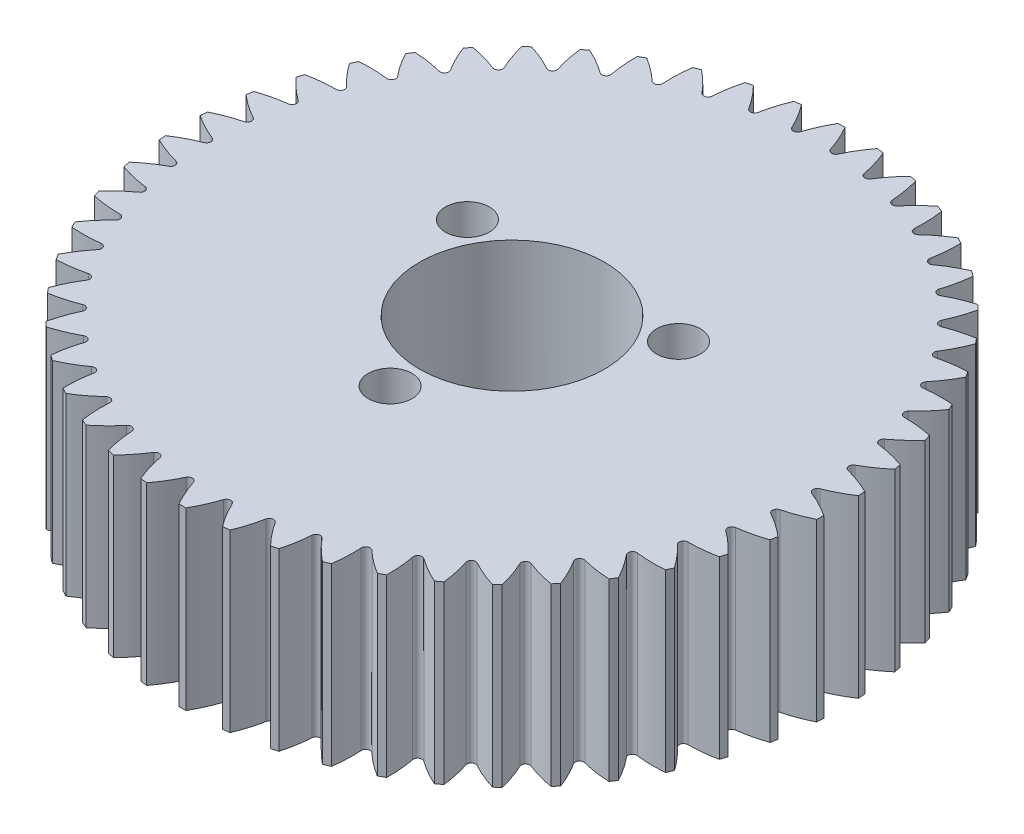
from build123d import *

# Parameters (mm, degrees)
SKETCH1_W                                        = 33.8
SKETCH1_H                                        = 18
CUT_EXTRUDE1_DEPTH                               = 52.077196477
CIRPATTERN1_COUNT                                = 50
CBORE_FOR_M4_HEX_HEAD_MACHINE_SCREW1_D           = 4.5
CBORE_FOR_M4_HEX_HEAD_MACHINE_SCREW1_CBORE_D     = 8.25
CBORE_FOR_M4_HEX_HEAD_MACHINE_SCREW1_CBORE_DEPTH = 4
F_19_0_19_DIAMETER_HOLE1_D                       = 19
FILLET1_R                                        = 3


with BuildPart() as part:
    # Sketch1 → Revolve1 (revolve)
    with BuildSketch(Plane(origin=(0, 0, 0), x_dir=(-1, 0, 0), z_dir=(0, 0, -1)), mode=Mode.PRIVATE) as revolve1_sk:
        with Locations((-16.9, -9)):
            Rectangle(SKETCH1_W, SKETCH1_H)
    revolve(revolve1_sk.sketch.rotate(Axis((0, -18, 0), (0, 1, 0)), 270), axis=Axis((0, -18, 0), (0, 1, 0)))

    # Sketch2 → Cut-Extrude1 (cut, through all)
    with BuildSketch(Plane(origin=(0, 0, 0), x_dir=(-1, 0, 0), z_dir=(0, 1, 0))):
        with BuildLine():
            ThreePointArc((-32.252622566, 10.109813924), (-32.738110846, 8.405718186), (-33.133628606, 6.678521945))
            ThreePointArc((-33.133628606, 6.678521945), (-31.725415704, 7.08772981), (-30.282298801, 7.348360314))
            ThreePointArc((-30.282298801, 7.348360314), (-29.9050051, 7.678300266), (-30.076680306, 8.149191477))
            ThreePointArc((-30.076680306, 8.149191477), (-31.215733586, 9.072810599), (-32.252622566, 10.109813924))
        make_face()
    cut_extrude1 = extrude(amount=-CUT_EXTRUDE1_DEPTH, mode=Mode.SUBTRACT)

    # CirPattern1: Cut-Extrude1 ×50 about axis
    cirpattern1_axis = Axis((0, 0, 0), (0, 1, 0))
    for i in range(1, CIRPATTERN1_COUNT):
        add(cut_extrude1.rotate(cirpattern1_axis, i * 360 / CIRPATTERN1_COUNT), mode=Mode.SUBTRACT)

    # CBORE for M4 Hex Head Machine Screw1 (through all)
    with Locations(Plane(origin=(0, -18, 0), x_dir=(-1, 0, 0), z_dir=(0, -1, 0))):
        with Locations((0, -12.5), (10.825317547, 6.25), (-10.825317547, 6.25)):
            CounterBoreHole(CBORE_FOR_M4_HEX_HEAD_MACHINE_SCREW1_D / 2, CBORE_FOR_M4_HEX_HEAD_MACHINE_SCREW1_CBORE_D / 2, CBORE_FOR_M4_HEX_HEAD_MACHINE_SCREW1_CBORE_DEPTH)

    # Ø19.0 (19) Diameter Hole1 (through all)
    with Locations(Plane(origin=(0, 0, 0), x_dir=(1, 0, 0), z_dir=(0, 1, 0))):
        with Locations((0, 0)):
            Hole(F_19_0_19_DIAMETER_HOLE1_D / 2)

    # Fillet1
    # the kernel refuses this fillet: 3 mm, written as the material it takes off along each edge
    with BuildSketch(Plane(origin=(6.725942645, -14, -6.709075609), x_dir=(0.421280354634154, 0, -0.9069304619425469), z_dir=(0, -1, 0)), Plane(origin=(-9.173201236, -14, -2.470299391), x_dir=(-0.9960649968274446, 0, 0.08862574171843556), z_dir=(0, -1, 0)), Plane(origin=(2.447258591, -14, 9.179375), x_dir=(0.574784642226881, 0, 0.8183047201746526), z_dir=(0, -1, 0))) as fillet1_piece_1:
        with BuildLine():
            CenterArc((3.574463067, -2.844543643), FILLET1_R, 108.525703367, 73.441151411)
            ThreePointArc((0.57623052, -2.947507693), (0.405329241, -1.450838801), (0, 0))
            ThreePointArc((0, 0), (1.310636458, -0.213752491), (2.621272916, 0))
        make_face()
    extrude(amount=11.508263453, mode=Mode.SUBTRACT)
    with BuildSketch(Plane(origin=(-6.725942645, -14, -6.709075609), x_dir=(-0.4212803546341543, 0, -0.9069304619425468), z_dir=(0, -1, 0)), Plane(origin=(-2.447258591, -14, 9.179375), x_dir=(-0.574784642226881, 0, 0.8183047201746526), z_dir=(0, -1, 0)), Plane(origin=(9.173201236, -14, -2.470299391), x_dir=(0.9960649968274446, 0, 0.08862574171843596), z_dir=(0, -1, 0))) as fillet1_piece_2:
        with BuildLine():
            CenterArc((3.574463067, 2.844543643), FILLET1_R, 178.033145222, 73.441151411)
            ThreePointArc((0.57623052, 2.947507693), (0.405329241, 1.450838801), (0, 0))
            ThreePointArc((0, 0), (1.310636458, 0.213752491), (2.621272916, 0))
        make_face()
    extrude(amount=11.508263453, mode=Mode.SUBTRACT)


solid = part.part
